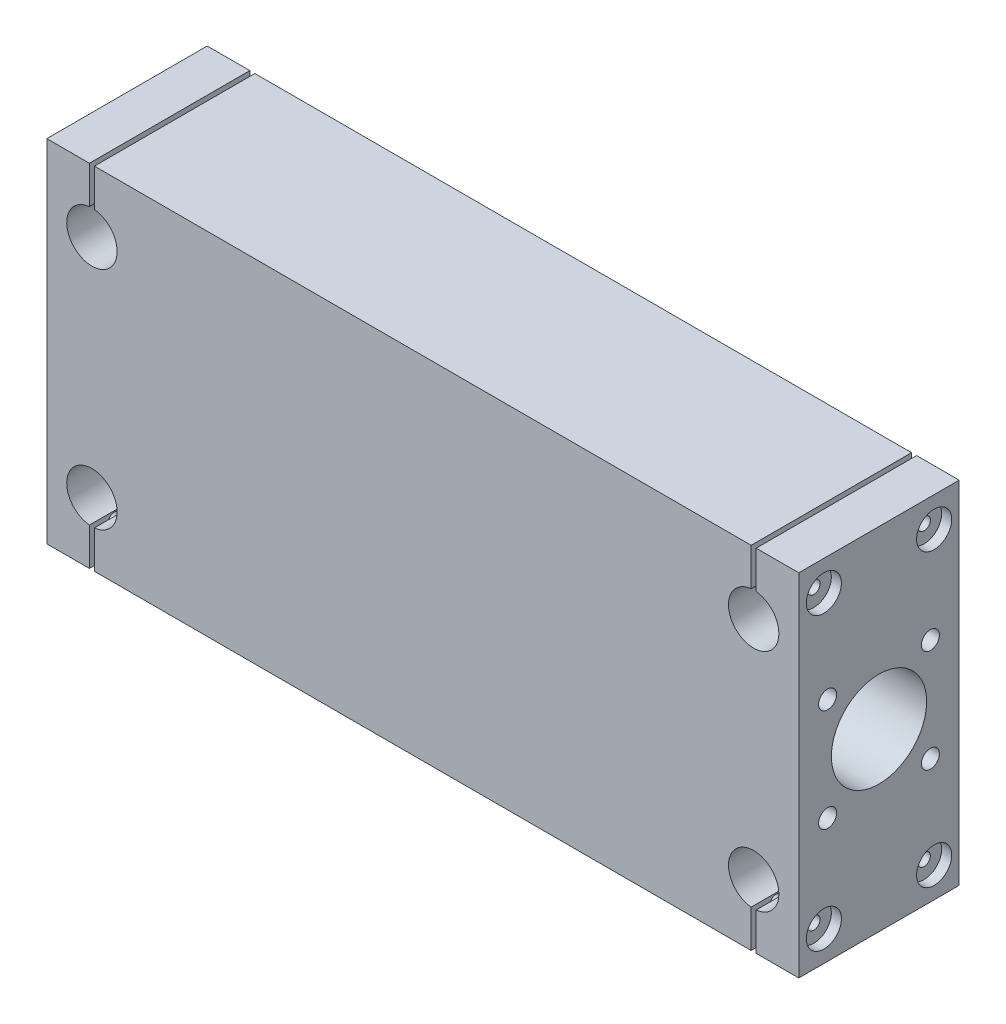
from build123d import *

# Parameters (mm, degrees)
SKETCH1_W                      = 150
SKETCH1_H                      = 70
BOSS_EXTRUDE1_DEPTH            = 32
SKETCH2_R                      = 9.5
LINEAR_BEARING_CUT_1_DEPTH     = 55
Y_AXIS_SHAFTS_CUT_DEPTH        = 169.594187326
LINEAR_BEARING_CUT_2_START     = -55
SKETCH7_R                      = 9.5
LINEAR_BEARING_CUT_2_DEPTH     = 55
SKETCH6_R                      = 6
BETWEEN_BEARINGS_DEPTH         = 123.266103234
SKETCH8_R                      = 3.5
SHAFT_HOLDER_SCREW_CUT_DEPTH   = 4
SKETCH9_R                      = 1.25
SHAFT_HOLDER_SCREW_CUT2_DEPTH  = 20
SHAFT_HOLDER_SCREW_CUT_3_START = -2
SKETCH10_R                     = 3.5
SHAFT_HOLDER_SCREW_CUT_3_DEPTH = 2
SHAFT_HOLDER_SCREW_CUT_4_START = -20
SKETCH11_R                     = 1.25
SHAFT_HOLDER_SCREW_CUT_4_DEPTH = 20
SKETCH12_R                     = 1.8
LINEAR_BEARING_SREW1_DEPTH     = 14
SKETCH13_R                     = 1.85
LINEAR_BEARING_SCREW2_DEPTH    = 14


with BuildPart() as part:
    # Sketch1 → Boss-Extrude1 (new body)
    with BuildSketch(Plane.XY):
        with Locations((-75, -35)):
            Rectangle(SKETCH1_W, SKETCH1_H)
    extrude(amount=BOSS_EXTRUDE1_DEPTH)

    # Sketch2 → Linear_bearing-cut-1 (cut)
    with BuildSketch(Plane.ZY.offset(150)):
        with Locations((16, -35)):
            Circle(SKETCH2_R)
    extrude(amount=-LINEAR_BEARING_CUT_1_DEPTH, mode=Mode.SUBTRACT)

    # Sketch5 → Y-axis-shafts-cut (cut, through all)
    with BuildSketch(Plane.XY.offset(32)):
        with BuildLine():
            Line((-141.5, 0), (-141.5, -7.5))
            ThreePointArc((-141.5, -7.5), (-141, -17.524937811), (-140.5, -7.5))
            Line((-140.5, -7.5), (-140.5, 0))
            Line((-140.5, 0), (-141.5, 0))
        make_face()
        with BuildLine():
            Line((-8.5, 0), (-8.5, -7.5))
            ThreePointArc((-8.5, -7.5), (-9, -17.524937811), (-9.5, -7.5))
            Line((-9.5, -7.5), (-9.5, 0))
            Line((-9.5, 0), (-8.5, 0))
        make_face()
        with BuildLine():
            Line((-141.5, -70), (-141.5, -62.5))
            ThreePointArc((-141.5, -62.5), (-141, -52.475062189), (-140.5, -62.5))
            Line((-140.5, -62.5), (-140.5, -70))
            Line((-140.5, -70), (-141.5, -70))
        make_face()
        with BuildLine():
            Line((-9.5, -70), (-9.5, -62.5))
            ThreePointArc((-9.5, -62.5), (-9, -52.475062189), (-8.5, -62.5))
            Line((-8.5, -62.5), (-8.5, -70))
            Line((-8.5, -70), (-9.5, -70))
        make_face()
    extrude(amount=-Y_AXIS_SHAFTS_CUT_DEPTH, mode=Mode.SUBTRACT)

    # Sketch7 → Linear-bearing-cut-2 (cut)
    with BuildSketch(Plane(origin=(0, 0, 0), x_dir=(0, 0, -1), z_dir=(1, 0, 0)).offset(LINEAR_BEARING_CUT_2_START)):
        with Locations((-16, -35)):
            Circle(SKETCH7_R)
    extrude(amount=LINEAR_BEARING_CUT_2_DEPTH, mode=Mode.SUBTRACT)

    # Sketch6 → between-bearings (cut, through all)
    with BuildSketch(Plane.ZY.offset(95)):
        with Locations((16, -35)):
            Circle(SKETCH6_R)
    extrude(amount=-BETWEEN_BEARINGS_DEPTH, mode=Mode.SUBTRACT)

    # Sketch8 → shaft-holder-screw-cut (cut)
    with BuildSketch(Plane.ZY.offset(150)):
        with Locations((5, -6)):
            Circle(SKETCH8_R)
        with Locations((27, -6)):
            Circle(SKETCH8_R)
        with Locations((27, -64)):
            Circle(SKETCH8_R)
        with Locations((5, -64)):
            Circle(SKETCH8_R)
    extrude(amount=-SHAFT_HOLDER_SCREW_CUT_DEPTH, mode=Mode.SUBTRACT)

    # Sketch9 → shaft-holder-screw-cut2 (cut)
    with BuildSketch(Plane.ZY.offset(146)):
        with Locations((5, -6)):
            Circle(SKETCH9_R)
        with Locations((27, -6)):
            Circle(SKETCH9_R)
        with Locations((5, -64)):
            Circle(SKETCH9_R)
        with Locations((27, -64)):
            Circle(SKETCH9_R)
    extrude(amount=-SHAFT_HOLDER_SCREW_CUT2_DEPTH, mode=Mode.SUBTRACT)

    # Sketch10 → shaft-holder-screw-cut-3 (cut)
    with BuildSketch(Plane(origin=(0, 0, 0), x_dir=(0, 0, -1), z_dir=(1, 0, 0)).offset(SHAFT_HOLDER_SCREW_CUT_3_START)):
        with Locations((-27, -6)):
            Circle(SKETCH10_R)
        with Locations((-5, -6)):
            Circle(SKETCH10_R)
        with Locations((-5, -64)):
            Circle(SKETCH10_R)
        with Locations((-27, -64)):
            Circle(SKETCH10_R)
    extrude(amount=SHAFT_HOLDER_SCREW_CUT_3_DEPTH, mode=Mode.SUBTRACT)

    # Sketch11 → shaft-holder-screw-cut-4 (cut)
    with BuildSketch(Plane(origin=(-2, 0, 0), x_dir=(0, 0, -1), z_dir=(1, 0, 0)).offset(SHAFT_HOLDER_SCREW_CUT_4_START)):
        with Locations((-27, -6)):
            Circle(SKETCH11_R)
        with Locations((-5, -6)):
            Circle(SKETCH11_R)
        with Locations((-5, -64)):
            Circle(SKETCH11_R)
        with Locations((-27, -64)):
            Circle(SKETCH11_R)
    extrude(amount=SHAFT_HOLDER_SCREW_CUT_4_DEPTH, mode=Mode.SUBTRACT)

    # Sketch12 → Linear-bearing-srew1 (cut)
    with BuildSketch(Plane(origin=(0, 0, 0), x_dir=(0, 0, -1), z_dir=(1, 0, 0))):
        with Locations((-5.75, -24.75)):
            Circle(SKETCH12_R)
        with Locations((-26.25, -24.75)):
            Circle(SKETCH12_R)
        with Locations((-5.75, -45.25)):
            Circle(SKETCH12_R)
        with Locations((-26.25, -45.25)):
            Circle(SKETCH12_R)
    extrude(amount=-LINEAR_BEARING_SREW1_DEPTH, mode=Mode.SUBTRACT)

    # Sketch13 → Linear-bearing-screw2 (cut)
    with BuildSketch(Plane.ZY.offset(150)):
        with Locations((27.5, -24.75)):
            Circle(SKETCH13_R)
        with Locations((4.5, -24.75)):
            Circle(SKETCH13_R)
        with Locations((27.5, -45.25)):
            Circle(SKETCH13_R)
        with Locations((4.5, -45.25)):
            Circle(SKETCH13_R)
    extrude(amount=-LINEAR_BEARING_SCREW2_DEPTH, mode=Mode.SUBTRACT)


solid = part.part
